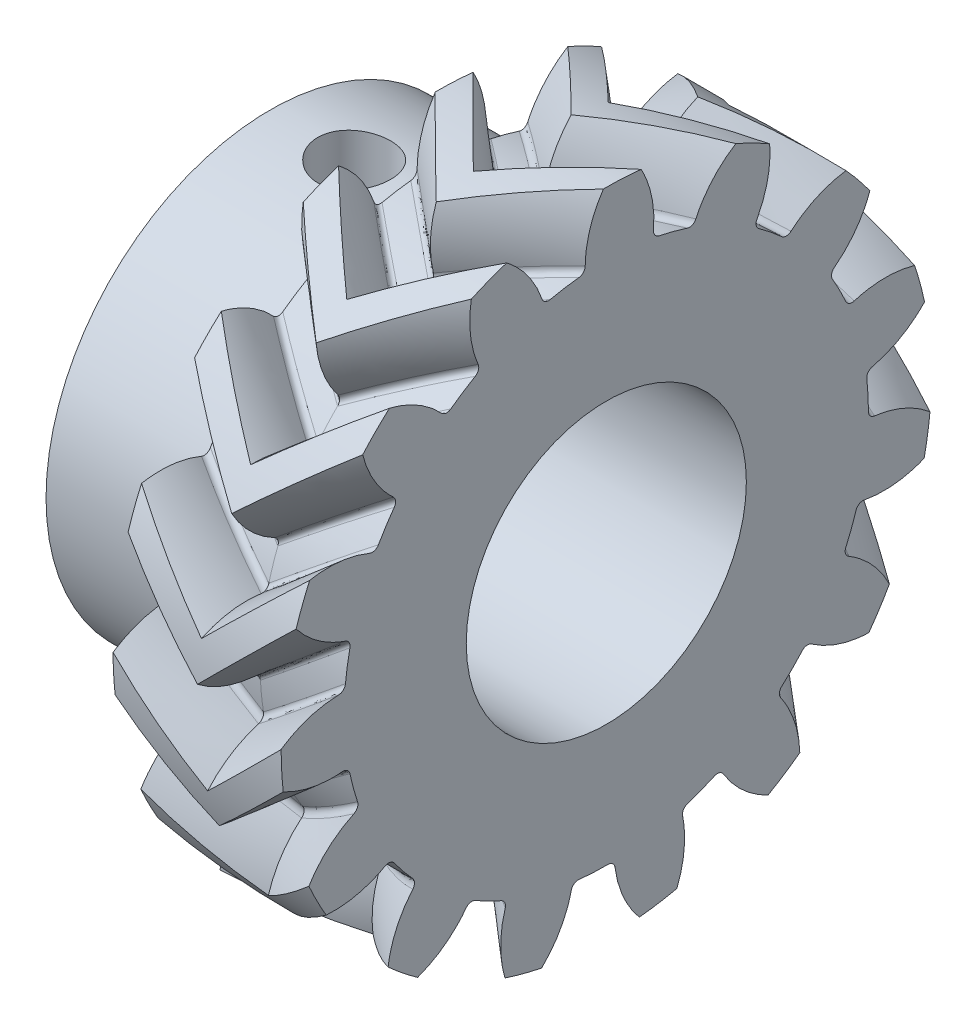
from build123d import *

# Parameters (mm, degrees)
BASPROSKE_W              = 3
BASPROSKE_H              = 11.606601718
TOOTHCUTLH_PITCH         = 72.92642938
TOOTHCUTLH_HEIGHT        = 3
TOOTHCUTLH_RADIUS        = 11.606601718
TOOTHCUTLH_START_ANGLE   = -90
TEETHCUTSLH_COUNT        = 15
TEETHCUTSLH_ANGLE        = 336
BORSKE_R                 = 5
BORE_DEPTH               = 62.5000025
SKETCH_1_R               = 8
SKETCH_1_R_2             = 5
EXTRUDE_1_DEPTH          = 6
CUT_EXTRUDE_1_DEPTH      = 19.719679792
CUT_EXTRUDE_1_DEPTH_BACK = 19.719679792
SKETCH_2_R               = 1.3


with BuildPart() as part:
    # BasProSke → Base-Revolve (revolve)
    with BuildSketch(Plane(origin=(0, 0, 0), x_dir=(1, 0, 0), z_dir=(0, 1, 0)), mode=Mode.PRIVATE) as base_revolve_sk:
        with Locations((1.5, 5.803300859)):
            Rectangle(BASPROSKE_W, BASPROSKE_H)
    revolve(base_revolve_sk.sketch.rotate(Axis((-10, 0, 0), (1, 0, 0)), 180), axis=Axis((-10, 0, 0), (1, 0, 0)))

    # ToothCutLH: sweep along a helix
    with BuildLine() as toothcutlh_path:
        add(Helix(TOOTHCUTLH_PITCH, TOOTHCUTLH_HEIGHT, TOOTHCUTLH_RADIUS, center=(0, 0, 0), direction=(1, 0, 0), lefthand=True, mode=Mode.PRIVATE).rotate(Axis((0, 0, 0), (1, 0, 0)), TOOTHCUTLH_START_ANGLE))
    # TooCutSkeRH<3> → ToothCutLH (sweep, cut)
    with BuildSketch(Plane(origin=(0, 0, 0), x_dir=(0, 0, -1), z_dir=(1, 0, 0))):
        with BuildLine():
            ThreePointArc((0.520162537, 9.342131804), (0, 9.356601718), (-0.520162537, 9.342131804))
            ThreePointArc((-0.520162537, 9.342131804), (-0.69008972, 9.396088288), (-0.781322065, 9.549265339))
            ThreePointArc((-0.781322065, 9.549265339), (-1.227561058, 10.775594128), (-2.067030428, 11.774745124))
            ThreePointArc((-2.067030428, 11.774745124), (0, 11.954799769), (2.067030428, 11.774745124))
            ThreePointArc((2.067030428, 11.774745124), (1.227561058, 10.775594128), (0.781322065, 9.549265339))
            ThreePointArc((0.781322065, 9.549265339), (0.69008972, 9.396088288), (0.520162537, 9.342131804))
        make_face()
    toothcutlh = sweep(path=toothcutlh_path.line, is_frenet=True, mode=Mode.SUBTRACT)

    # TeethCutsLH: ToothCutLH ×15 about axis
    teethcutslh_axis = Axis((-10, 0, 0), (1, 0, 0))
    for i in range(1, TEETHCUTSLH_COUNT):
        add(toothcutlh.rotate(teethcutslh_axis, i * TEETHCUTSLH_ANGLE / (TEETHCUTSLH_COUNT - 1)), mode=Mode.SUBTRACT)

    # BorSke → Bore (cut, symmetric)
    with BuildSketch(Plane(origin=(0, 0, 0), x_dir=(0, 0, -1), z_dir=(1, 0, 0))):
        with Locations(Location((0, 0, 0), (0, 0, 180))):
            Circle(BORSKE_R)
    extrude(amount=BORE_DEPTH, both=True, mode=Mode.SUBTRACT)

    # 鏡射1: part across plane


with BuildPart() as part_1:
    add(part.part)
    add(part.part.mirror(Plane(origin=(0, 0, 0), x_dir=(0, 0, 1), z_dir=(1, 0, 0))))

    # 草圖1 → 填料-伸長1 (add)
    with BuildSketch(Plane(origin=(-3, 0, 0), x_dir=(0, 0, -1), z_dir=(1, 0, 0))):
        Circle(SKETCH_1_R)
        with Locations(Location((0, 0, 0), (0, 0, 180))):
            Circle(SKETCH_1_R_2, mode=Mode.SUBTRACT)
    extrude(amount=-EXTRUDE_1_DEPTH)

    # 草圖2 → 除料-伸長1 (cut, two sides: drawn at the far end of the back side and taken through both)
    with BuildSketch(Plane(origin=(0, 0, 0), x_dir=(1, 0, 0), z_dir=(0, 1, 0)).offset(-CUT_EXTRUDE_1_DEPTH_BACK)):
        with Locations(Location((-6, 0, 0), (0, 0, 270))):
            Circle(SKETCH_2_R)
    extrude(amount=CUT_EXTRUDE_1_DEPTH + CUT_EXTRUDE_1_DEPTH_BACK, mode=Mode.SUBTRACT)


solid = part_1.part
